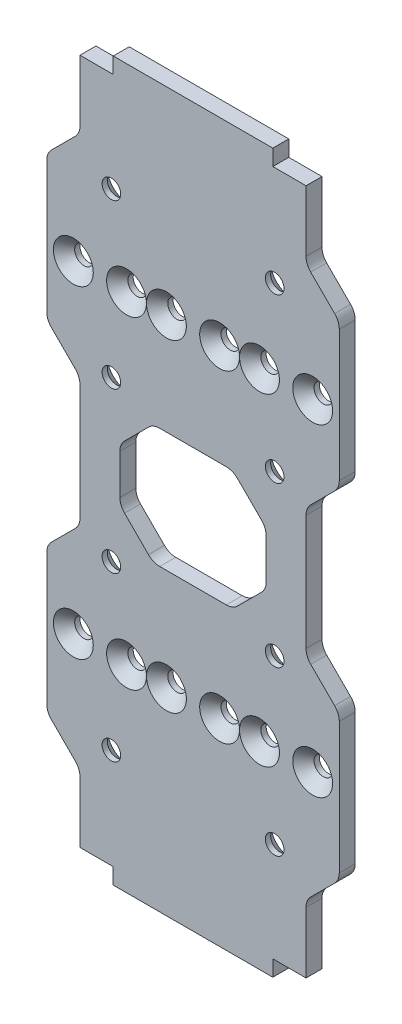
from build123d import *

# Parameters (mm, degrees)
SKETCH_1_W          = 55
SKETCH_1_H          = 129
SKETCH_1_W_2        = 30
SKETCH_1_H_2        = 6
EXTRUDE_1_DEPTH     = 3
SKETCH_2_R          = 1.75
CUT_EXTRUDE_1_DEPTH = 10
SKETCH_3_R          = 1.75
CUT_EXTRUDE_2_DEPTH = 10
CHAMFER_1_SIZE      = 2
CHAMFER_2_SIZE      = 2
CUT_EXTRUDE_3_DEPTH = 3
CUT_EXTRUDE_4_DEPTH = 10
FILLET_1_R          = 3
FILLET_2_R          = 3


with BuildPart() as part:
    # Эскиз1 → Бобышка-Вытянуть1 (new body)
    with BuildSketch(Plane.XY):
        Rectangle(SKETCH_1_W, SKETCH_1_H)
        with Locations((0, 64.5)):
            Rectangle(SKETCH_1_W_2, SKETCH_1_H_2)
        with Locations((0, -64.5)):
            Rectangle(SKETCH_1_W_2, SKETCH_1_H_2)
    extrude(amount=EXTRUDE_1_DEPTH)

    # Эскиз2 → Вырез-Вытянуть1 (cut)
    with BuildSketch(Plane.XY.offset(3)):
        with Locations((-15.35, 45.7)):
            Circle(SKETCH_2_R)
        with Locations((15.35, 45.7)):
            Circle(SKETCH_2_R)
        with Locations((15.35, 15)):
            Circle(SKETCH_2_R)
        with Locations((-15.35, 15)):
            Circle(SKETCH_2_R)
        with Locations((-15.35, -15)):
            Circle(SKETCH_2_R)
        with Locations((15.35, -15)):
            Circle(SKETCH_2_R)
        with Locations((15.35, -45.7)):
            Circle(SKETCH_2_R)
        with Locations((-15.35, -45.7)):
            Circle(SKETCH_2_R)
    extrude(amount=-CUT_EXTRUDE_1_DEPTH, mode=Mode.SUBTRACT)

    # Эскиз3 → Вырез-Вытянуть2 (cut)
    with BuildSketch(Plane(origin=(0, 0, 0), x_dir=(-1, 0, 0), z_dir=(0, 0, -1))):
        with Locations((-22.5, 30.35)):
            Circle(SKETCH_3_R)
        with Locations((-12.5, 30.35)):
            Circle(SKETCH_3_R)
        with Locations((-5, 30.35)):
            Circle(SKETCH_3_R)
        with Locations((5, 30.35)):
            Circle(SKETCH_3_R)
        with Locations((12.5, 30.35)):
            Circle(SKETCH_3_R)
        with Locations((22.5, 30.35)):
            Circle(SKETCH_3_R)
        with Locations(Location((22.5, -30.35, 0), (0, 0, 180))):
            Circle(SKETCH_3_R)
        with Locations(Location((12.5, -30.35, 0), (0, 0, 180))):
            Circle(SKETCH_3_R)
        with Locations(Location((5, -30.35, 0), (0, 0, 180))):
            Circle(SKETCH_3_R)
        with Locations(Location((-5, -30.35, 0), (0, 0, 180))):
            Circle(SKETCH_3_R)
        with Locations(Location((-12.5, -30.35, 0), (0, 0, 180))):
            Circle(SKETCH_3_R)
        with Locations(Location((-22.5, -30.35, 0), (0, 0, 180))):
            Circle(SKETCH_3_R)
    extrude(amount=-CUT_EXTRUDE_2_DEPTH, mode=Mode.SUBTRACT)

    # Фаска1
    chamfer_1_edges = [part.edges().sort_by_distance(p)[0] for p in [
        (-17.1, -15, 0),
        (-17.1, 15, 0),
        (13.6, 15, 0),
        (-17.1, 45.7, 0),
        (13.6, -15, 0),
        (13.6, -45.7, 0),
        (-17.1, -45.7, 0),
        (13.6, 45.7, 0),
    ]]
    chamfer(chamfer_1_edges, length=CHAMFER_1_SIZE)

    # Фаска2
    chamfer_2_edges = [part.edges().sort_by_distance(p)[0] for p in [
        (-6.75, -30.35, 3),
        (-14.25, -30.35, 3),
        (-24.25, -30.35, 3),
        (-20.75, 30.35, 3),
        (-10.75, 30.35, 3),
        (-3.25, 30.35, 3),
        (6.75, 30.35, 3),
        (14.25, 30.35, 3),
        (3.25, -30.35, 3),
        (10.75, -30.35, 3),
        (20.75, -30.35, 3),
        (24.25, 30.35, 3),
    ]]
    chamfer(chamfer_2_edges, length=CHAMFER_2_SIZE - 0.0001)  # a hair under: the kernel refuses the full size

    # Эскиз4 → Вырез-Вытянуть3 (cut)
    with BuildSketch(Plane(origin=(0, 0, 0), x_dir=(-1, 0, 0), z_dir=(0, 0, -1))):
        Polygon((7.5, 11.25), (-7.5, 11.25), (-13.75, 5), (-13.75, -5), (-7.5, -11.25), (7.5, -11.25), (13.75, -5), (13.75, 5), align=None)
    extrude(amount=-CUT_EXTRUDE_3_DEPTH, mode=Mode.SUBTRACT)

    # Эскиз6 → Вырез-Вытянуть4 (cut)
    with BuildSketch(Plane.XY.offset(3)):
        Polygon((21.25, 64.5), (21.25, 51.75), (27.5, 45.5), (29.222592787, 45.5), (29.222592787, 64.5), align=None)
        Polygon((-29.222592787, 45.5), (-27.5, 45.5), (-21.25, 51.75), (-21.25, 64.5), (-29.222592787, 64.5), align=None)
        Polygon((-21.25, -64.5), (-21.25, -51.75), (-27.5, -45.5), (-29.222592787, -45.5), (-29.222592787, -64.5), align=None)
        Polygon((29.222592787, -45.5), (27.5, -45.5), (21.25, -51.75), (21.25, -64.5), (29.222592787, -64.5), align=None)
        Polygon((-27.5, 18.35), (-21.25, 12.1), (-21.25, -12.1), (-27.5, -18.35), (-29.834520007, -18.35), (-29.834520007, 18.35), align=None)
        Polygon((27.5, -18.35), (21.25, -12.1), (21.25, 12.1), (27.5, 18.35), (30.388553895, 18.35), (30.388553895, -18.35), align=None)
    extrude(amount=-CUT_EXTRUDE_4_DEPTH, mode=Mode.SUBTRACT)

    # Скругление1
    fillet_1_edges = [part.edges().sort_by_distance(p)[0] for p in [
        (-27.5, 18.35, 1.5),
        (-21.25, 12.1, 1.5),
        (-21.25, -12.1, 1.5),
        (-27.5, -18.35, 1.5),
        (21.25, -51.75, 1.5),
        (27.5, -45.5, 1.5),
        (-27.5, -45.5, 1.5),
        (-21.25, -51.75, 1.5),
        (-21.25, 51.75, 1.5),
        (-27.5, 45.5, 1.5),
        (27.5, -18.35, 1.5),
        (21.25, -12.1, 1.5),
        (21.25, 12.1, 1.5),
        (27.5, 18.35, 1.5),
        (27.5, 45.5, 1.5),
        (21.25, 51.75, 1.5),
    ]]
    fillet(fillet_1_edges, radius=FILLET_1_R)

    # Скругление2
    fillet_2_edges = [part.edges().sort_by_distance(p)[0] for p in [
        (-7.5, -11.25, 1.5),
        (7.5, -11.25, 1.5),
        (13.75, -5, 1.5),
        (13.75, 5, 1.5),
        (7.5, 11.25, 1.5),
        (-7.5, 11.25, 1.5),
        (-13.75, 5, 1.5),
        (-13.75, -5, 1.5),
    ]]
    fillet(fillet_2_edges, radius=FILLET_2_R)


solid = part.part
